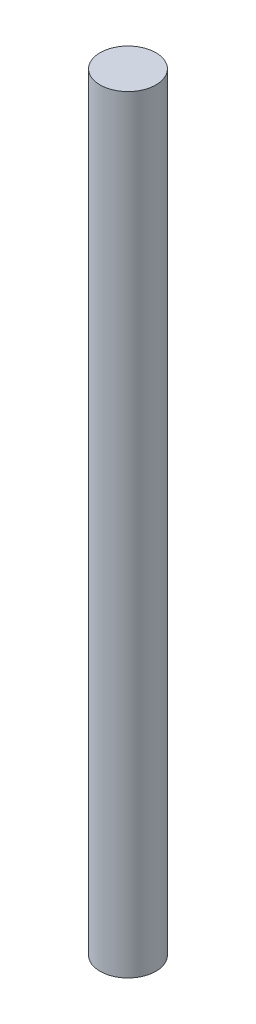
from build123d import *

# Parameters (mm, degrees)
SKETCH_1_R      = 4
EXTRUDE_1_DEPTH = 110


with BuildPart() as part:
    # Эскиз1 → Бобышка-Вытянуть1 (new body)
    with BuildSketch(Plane(origin=(0, 0, 0), x_dir=(1, 0, 0), z_dir=(0, 1, 0))):
        Circle(SKETCH_1_R)
    extrude(amount=EXTRUDE_1_DEPTH)


solid = part.part
